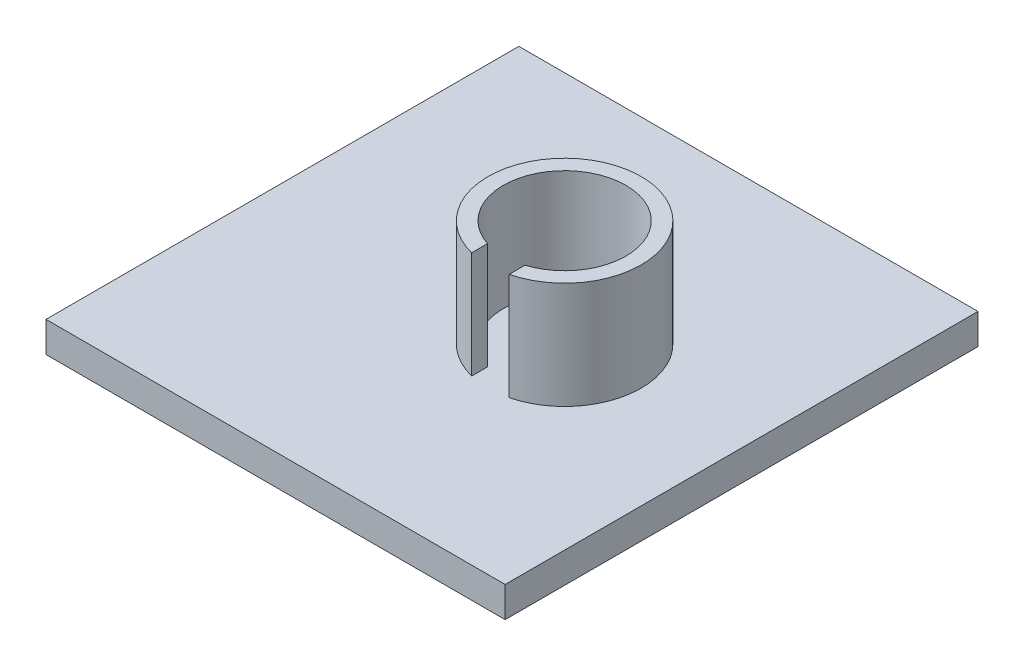
from build123d import *

# Parameters (mm, degrees)
SKETCH1_W            = 160
SKETCH1_H            = 160
BOSS_EXTRUDE1_DEPTH  = 5
BOSS_EXTRUDE8_DEPTH  = 35
SKETCH23_W           = 160
SKETCH23_H           = 10
BOSS_EXTRUDE12_DEPTH = 20
SKETCH25_W           = 21.5
SKETCH25_H           = 180
CUT_EXTRUDE4_DEPTH   = 10
SKETCH27_W           = 138.5
SKETCH27_H           = 25
CUT_EXTRUDE5_DEPTH   = 10
SKETCH28_W           = 10
SKETCH28_H           = 155
BOSS_EXTRUDE14_DEPTH = 10
SKETCH39_W           = 7
SKETCH39_H           = 155
BOSS_EXTRUDE18_DEPTH = 10


with BuildPart() as part:
    # Sketch1 → Boss-Extrude1 (new, symmetric)
    with BuildSketch(Plane(origin=(0, 0, 0), x_dir=(1, 0, 0), z_dir=(0, 1, 0))):
        Rectangle(SKETCH1_W, SKETCH1_H)
    extrude(amount=BOSS_EXTRUDE1_DEPTH, both=True)

    # Sketch17 → Boss-Extrude8 (add)
    with BuildSketch(Plane(origin=(0, 5, 0), x_dir=(1, 0, 0), z_dir=(0, 1, 0))):
        with BuildLine():
            Line((-6.135166846, 3.859212979), (-6.135166846, -1.338646794))
            ThreePointArc((-6.135166846, -1.338646794), (0, 48.1), (6.135166846, -1.338646794))
            Line((6.135166846, -1.338646794), (6.135166846, 3.859212979))
            ThreePointArc((6.135166846, 3.859212979), (0, 43.1), (-6.135166846, 3.859212979))
        make_face()
    extrude(amount=BOSS_EXTRUDE8_DEPTH)

    # Sketch23 → Boss-Extrude12 (add)
    with BuildSketch(Plane(origin=(0, 0, -80), x_dir=(-1, 0, 0), z_dir=(0, 0, -1))):
        Rectangle(SKETCH23_W, SKETCH23_H)
    extrude(amount=BOSS_EXTRUDE12_DEPTH)

    # Sketch25 → Cut-Extrude4 (cut)
    with BuildSketch(Plane(origin=(0, 5, 0), x_dir=(1, 0, 0), z_dir=(0, 1, 0))):
        with Locations((69.25, 10)):
            Rectangle(SKETCH25_W, SKETCH25_H)
    extrude(amount=-CUT_EXTRUDE4_DEPTH, mode=Mode.SUBTRACT)

    # Sketch27 → Cut-Extrude5 (cut)
    with BuildSketch(Plane(origin=(0, 5, 0), x_dir=(1, 0, 0), z_dir=(0, 1, 0))):
        with Locations((-10.75, -67.5)):
            Rectangle(SKETCH27_W, SKETCH27_H)
    extrude(amount=-CUT_EXTRUDE5_DEPTH, mode=Mode.SUBTRACT)

    # Sketch28 → Boss-Extrude14 (add)
    with BuildSketch(Plane(origin=(0, 5, 0), x_dir=(1, 0, 0), z_dir=(0, 1, 0))):
        with Locations((-85, 22.5)):
            Rectangle(SKETCH28_W, SKETCH28_H)
    extrude(amount=-BOSS_EXTRUDE14_DEPTH)

    # Sketch39 → Boss-Extrude18 (add)
    with BuildSketch(Plane(origin=(0, 5, 0), x_dir=(1, 0, 0), z_dir=(0, 1, 0))):
        with Locations((-88.5, 22.5)):
            Rectangle(SKETCH39_W, SKETCH39_H)
    extrude(amount=-BOSS_EXTRUDE18_DEPTH)


solid = part.part
